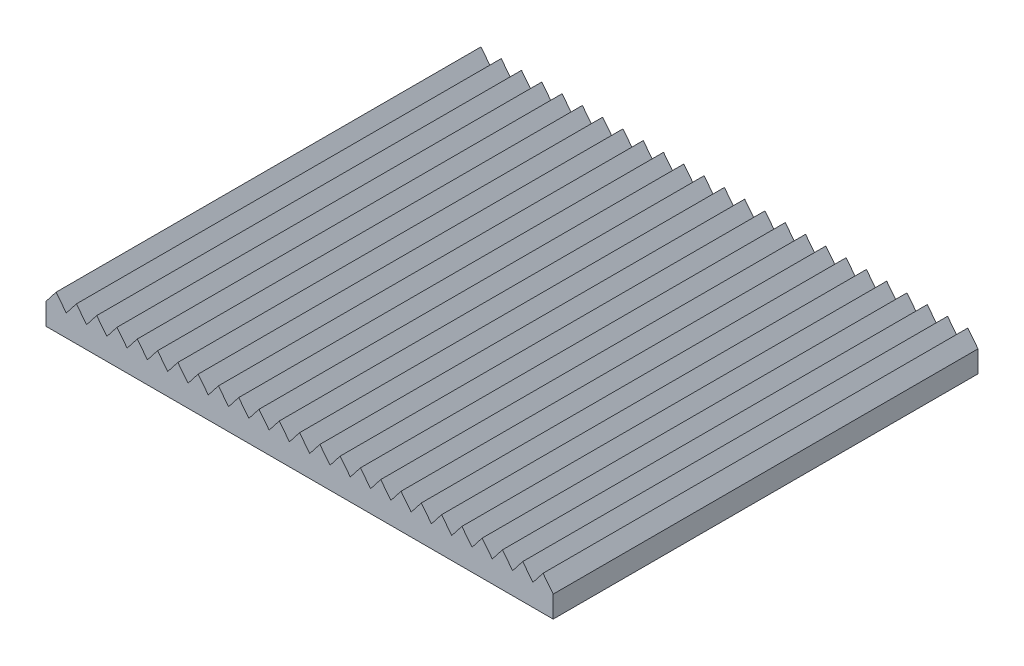
from build123d import *

# Parameters (mm, degrees)
SKETCH1_W           = 58.5
SKETCH1_H           = 49
SKETCH1_R           = 3.1
BOSS_EXTRUDE1_DEPTH = 1.5
BOSS_EXTRUDE2_DEPTH = 49
CUT_EXTRUDE1_DEPTH  = 2
CHAMFER1_SIZE       = 2
CHAMFER2_SIZE       = 0.2


with BuildPart() as part:
    # Sketch1 → Boss-Extrude1 (new body)
    with BuildSketch(Plane(origin=(0, 0, 0), x_dir=(1, 0, 0), z_dir=(0, 1, 0))):
        Rectangle(SKETCH1_W, SKETCH1_H)
        with Locations(Location((0, 0, 0), (0, 0, 270))):
            Circle(SKETCH1_R, mode=Mode.SUBTRACT)
    extrude(amount=BOSS_EXTRUDE1_DEPTH)

    # Sketch2 → Boss-Extrude2 (add)
    with BuildSketch(Plane(origin=(0, 0, -24.5), x_dir=(-1, 0, 0), z_dir=(0, 0, -1))):
        Polygon((-29.25, 1.5), (29.25, 1.5), (29.25, 2.5), (28.08, 4), (26.91, 2.5), (25.74, 4), (24.57, 2.5), (23.4, 4), (22.23, 2.5), (21.06, 4), (19.89, 2.5), (18.72, 4), (17.55, 2.5), (16.38, 4), (15.21, 2.5), (14.04, 4), (12.87, 2.5), (11.7, 4), (10.53, 2.5), (9.36, 4), (8.19, 2.5), (7.02, 4), (5.85, 2.5), (4.68, 4), (3.51, 2.5), (2.34, 4), (1.17, 2.5), (0, 4), (-1.17, 2.5), (-2.34, 4), (-3.51, 2.5), (-4.68, 4), (-5.85, 2.5), (-7.02, 4), (-8.19, 2.5), (-9.36, 4), (-10.53, 2.5), (-11.7, 4), (-12.87, 2.5), (-14.04, 4), (-15.21, 2.5), (-16.38, 4), (-17.55, 2.5), (-18.72, 4), (-19.89, 2.5), (-21.06, 4), (-22.23, 2.5), (-23.4, 4), (-24.57, 2.5), (-25.74, 4), (-26.91, 2.5), (-28.08, 4), (-29.25, 2.5), align=None)
    extrude(amount=-BOSS_EXTRUDE2_DEPTH)

    # Sketch3 → Cut-Extrude1 (cut)
    with BuildSketch(Plane(origin=(0, 0, 0), x_dir=(-1, 0, 0), z_dir=(0, -1, 0))):
        with BuildLine():
            Line((-1.75, -2.558808316), (-1.75, -5))
            Line((-1.75, -5), (1.75, -5))
            Line((1.75, -5), (1.75, -2.558808316))
            ThreePointArc((1.75, -2.558808316), (0, 3.1), (-1.75, -2.558808316))
        make_face()
    extrude(amount=-CUT_EXTRUDE1_DEPTH, mode=Mode.SUBTRACT)

    # Chamfer1
    chamfer1_edges = [part.edges().sort_by_distance(p)[0] for p in [
        (0, 0, 5),
    ]]
    chamfer(chamfer1_edges, length=CHAMFER1_SIZE - 0.0001)  # a hair under: the kernel refuses the full size

    # Chamfer2
    chamfer2_edges = [part.edges().sort_by_distance(p)[0] for p in [
        (0, 0, -3.1),
    ]]
    chamfer(chamfer2_edges, length=CHAMFER2_SIZE)


solid = part.part
